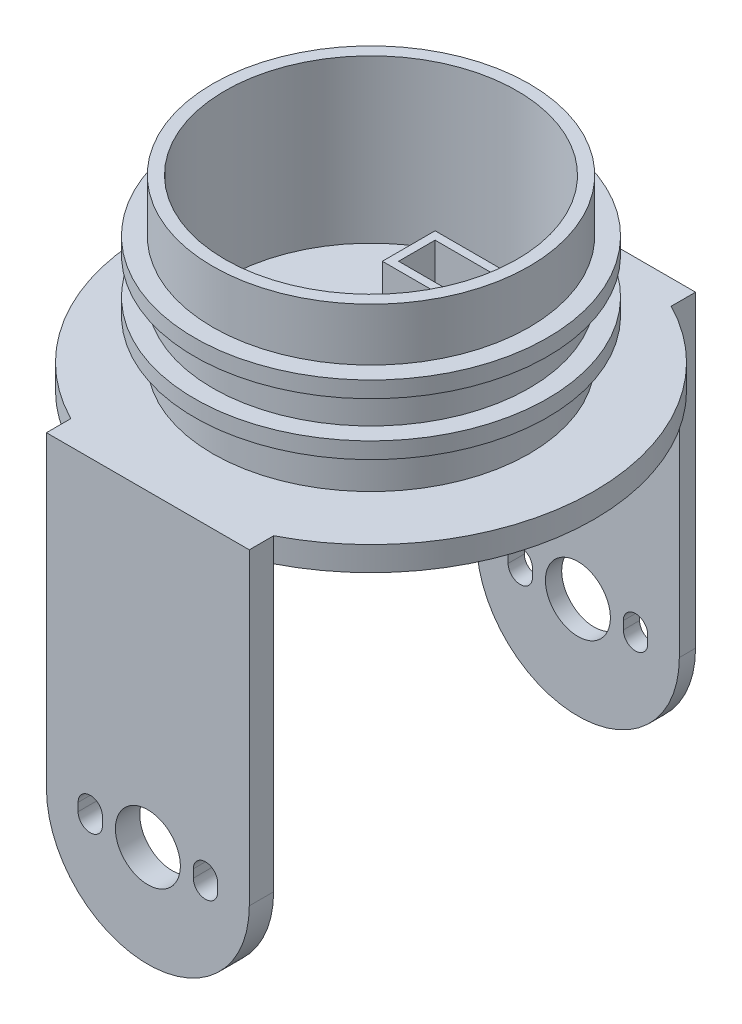
from build123d import *
from build123d.topology import SkipClean

# Parameters (mm, degrees)
SKETCH_1_R           = 19.5
SKETCH_1_R_2         = 18
EXTRUDE_1_DEPTH      = 20
SKETCH_3_R           = 27.5
EXTRUDE_2_DEPTH      = 3
EXTRUDE_START        = 2
SKETCH_25_R          = 21.75
SKETCH_25_R_2        = 19.5
EXTRUDE_12_DEPTH     = 2
EXTRUDE_START_2      = -1
SKETCH_26_R          = 21.75
SKETCH_26_R_2        = 19.5
EXTRUDE_13_DEPTH     = 2
SKETCH_27_W          = 25
SKETCH_27_H          = 51
EXTRUDE_14_DEPTH     = 3
SKETCH_28_R          = 4
EXTRUDE_17_DEPTH     = 2
EXTRUDE_START_3      = -53
SKETCH_28_15_R       = 4
EXTRUDE_19_DEPTH     = 53
SKETCH_32_W          = 2.204369859
SKETCH_32_H          = 3
EXTRUDE_20_DEPTH     = 2
CUT_EXTRUDE_START    = -50
SKETCH_28_18_R       = 4
CUT_EXTRUDE_8_DEPTH  = 50
SKETCH_33_W          = 25
SKETCH_33_H          = 3
EXTRUDE_21_DEPTH     = 3
SKETCH_34_W          = 10.2
SKETCH_34_H          = 6.5
SKETCH_34_W_2        = 8.2
SKETCH_34_H_2        = 4.5
EXTRUDE_22_DEPTH     = 5
SKETCH_37_W          = 8.2
SKETCH_37_H          = 4.5
CUT_EXTRUDE_9_DEPTH  = 5
SKETCH_38_R          = 6.3
SKETCH_38_R_2        = 4.8
EXTRUDE_23_DEPTH     = 8
CUT_EXTRUDE_10_DEPTH = 9.5
EXTRUDE_START_4      = 3
EXTRUDE_24_DEPTH     = 3


with BuildPart() as part:
    # 草圖1 → 填料-伸長1 (new body)
    with BuildSketch(Plane(origin=(0, 0, 0), x_dir=(1, 0, 0), z_dir=(0, 1, 0))):
        Circle(SKETCH_1_R)
        Circle(SKETCH_1_R_2, mode=Mode.SUBTRACT)
    extrude(amount=EXTRUDE_1_DEPTH)

    # 草圖3 → 填料-伸長2 (add)
    with BuildSketch(Plane.XZ):
        Circle(SKETCH_3_R)
    extrude(amount=EXTRUDE_2_DEPTH)

    # 草圖25 → 填料-伸長12 (add)
    with BuildSketch(Plane(origin=(0, 7, 0), x_dir=(-1, 0, 0), z_dir=(0, -1, 0)).offset(EXTRUDE_START)):
        Circle(SKETCH_25_R)
        Circle(SKETCH_25_R_2, mode=Mode.SUBTRACT)
    extrude(amount=-EXTRUDE_12_DEPTH)

    # 草圖26 → 填料-伸長13 (add)
    with BuildSketch(Plane(origin=(0, 10.5, 0), x_dir=(-1, 0, 0), z_dir=(0, -1, 0)).offset(EXTRUDE_START_2)):
        Circle(SKETCH_26_R)
        Circle(SKETCH_26_R_2, mode=Mode.SUBTRACT)
    extrude(amount=-EXTRUDE_13_DEPTH)

    # 草圖27 → 填料-伸長14 (add)
    with BuildSketch(Plane.XZ.offset(3)):
        Rectangle(SKETCH_27_W, SKETCH_27_H)
    extrude(amount=-EXTRUDE_14_DEPTH)

    # 草圖28 → 填料-伸長17 (add)
    with BuildSketch(Plane(origin=(0, 0, -25.5), x_dir=(-1, 0, 0), z_dir=(0, 0, -1))):
        with BuildLine():
            Line((12.5, 0), (-12.5, 0))
            Line((-12.5, 0), (-12.5, -38))
            ThreePointArc((-12.5, -38), (0, -50.5), (12.5, -38))
            Line((12.5, -38), (12.5, 0))
        make_face()
        with BuildLine():
            Line((8.6, -37.5), (8.6, -38.5))
            ThreePointArc((8.6, -38.5), (7.1, -40), (5.6, -38.5))
            Line((5.6, -38.5), (5.6, -37.5))
            ThreePointArc((5.6, -37.5), (7.1, -36), (8.6, -37.5))
        make_face(mode=Mode.SUBTRACT)
        with Locations((0, -38)):
            Circle(SKETCH_28_R, mode=Mode.SUBTRACT)
        with BuildLine():
            Line((-5.6, -37.5), (-5.6, -38.5))
            ThreePointArc((-5.6, -38.5), (-7.1, -40), (-8.6, -38.5))
            Line((-8.6, -38.5), (-8.6, -37.5))
            ThreePointArc((-8.6, -37.5), (-7.1, -36), (-5.6, -37.5))
        make_face(mode=Mode.SUBTRACT)
    extrude(amount=EXTRUDE_17_DEPTH)

    # 草圖28<15> → 填料-伸長19 (add)
    with BuildSketch(Plane(origin=(0, 0, -25.5), x_dir=(-1, 0, 0), z_dir=(0, 0, -1)).offset(EXTRUDE_START_3)):
        with BuildLine():
            Line((12.5, -38), (12.5, -3))
            Line((12.5, -3), (-12.5, -3))
            Line((-12.5, -3), (-12.5, -38))
            ThreePointArc((-12.5, -38), (0, -50.5), (12.5, -38))
        make_face()
        with BuildLine():
            Line((8.6, -37.5), (8.6, -38.5))
            ThreePointArc((8.6, -38.5), (7.1, -40), (5.6, -38.5))
            Line((5.6, -38.5), (5.6, -37.5))
            ThreePointArc((5.6, -37.5), (7.1, -36), (8.6, -37.5))
        make_face(mode=Mode.SUBTRACT)
        with Locations((0, -38)):
            Circle(SKETCH_28_15_R, mode=Mode.SUBTRACT)
        with BuildLine():
            Line((-5.6, -37.5), (-5.6, -38.5))
            ThreePointArc((-5.6, -38.5), (-7.1, -40), (-8.6, -38.5))
            Line((-8.6, -38.5), (-8.6, -37.5))
            ThreePointArc((-8.6, -37.5), (-7.1, -36), (-5.6, -37.5))
        make_face(mode=Mode.SUBTRACT)
    extrude(amount=EXTRUDE_19_DEPTH)

    # 草圖32 → 填料-伸長20 (add)
    with BuildSketch(Plane.XY.offset(25.5)):
        with Locations((11.397815071, -1.5)):
            Rectangle(SKETCH_32_W, SKETCH_32_H)
        with Locations((-11.397815071, -1.5)):
            Rectangle(SKETCH_32_W, SKETCH_32_H)
    extrude(amount=EXTRUDE_20_DEPTH)

    # 草圖28<18> → 除料-伸長8 (cut)
    with BuildSketch(Plane(origin=(0, 0, -25.5), x_dir=(-1, 0, 0), z_dir=(0, 0, -1)).offset(CUT_EXTRUDE_START)):
        with BuildLine():
            Line((12.5, -38), (12.5, -3))
            Line((12.5, -3), (-12.5, -3))
            Line((-12.5, -3), (-12.5, -38))
            ThreePointArc((-12.5, -38), (0, -50.5), (12.5, -38))
        make_face()
        with BuildLine():
            Line((8.6, -37.5), (8.6, -38.5))
            ThreePointArc((8.6, -38.5), (7.1, -40), (5.6, -38.5))
            Line((5.6, -38.5), (5.6, -37.5))
            ThreePointArc((5.6, -37.5), (7.1, -36), (8.6, -37.5))
        make_face(mode=Mode.SUBTRACT)
        with Locations((0, -38)):
            Circle(SKETCH_28_18_R, mode=Mode.SUBTRACT)
        with BuildLine():
            Line((-5.6, -37.5), (-5.6, -38.5))
            ThreePointArc((-5.6, -38.5), (-7.1, -40), (-8.6, -38.5))
            Line((-8.6, -38.5), (-8.6, -37.5))
            ThreePointArc((-8.6, -37.5), (-7.1, -36), (-5.6, -37.5))
        make_face(mode=Mode.SUBTRACT)
    extrude(amount=CUT_EXTRUDE_8_DEPTH, mode=Mode.SUBTRACT)

    # 草圖33 → 填料-伸長21 (add)
    with BuildSketch(Plane.XY.offset(27.5)):
        with Locations((0, -1.5)):
            Rectangle(SKETCH_33_W, SKETCH_33_H)
    extrude(amount=-EXTRUDE_21_DEPTH)

    # 草圖34 → 填料-伸長22 (add)
    with BuildSketch(Plane(origin=(0, 0, 0), x_dir=(1, 0, 0), z_dir=(0, 1, 0))):
        with Locations((0, 9.75)):
            Rectangle(SKETCH_34_W, SKETCH_34_H)
        with Locations((0, 9.75)):
            Rectangle(SKETCH_34_W_2, SKETCH_34_H_2, mode=Mode.SUBTRACT)
    extrude(amount=EXTRUDE_22_DEPTH)

    # 草圖37 → 除料-伸長9 (cut)
    with BuildSketch(Plane(origin=(0, 0, 0), x_dir=(1, 0, 0), z_dir=(0, 1, 0))):
        with Locations((0, 9.75)):
            Rectangle(SKETCH_37_W, SKETCH_37_H)
    extrude(amount=-CUT_EXTRUDE_9_DEPTH, mode=Mode.SUBTRACT)

    # 草圖38 → 填料-伸長23 (add)
    with BuildSketch(Plane(origin=(0, 0, -27.5), x_dir=(-1, 0, 0), z_dir=(0, 0, -1))):
        with Locations((0, -9.8)):
            Circle(SKETCH_38_R)
        with Locations((0, -9.8)):
            Circle(SKETCH_38_R_2, mode=Mode.SUBTRACT)
    extrude(amount=-EXTRUDE_23_DEPTH)

    # 草圖38<3> → 除料-伸長10 (cut)
    with BuildSketch(Plane(origin=(0, 0, -27.5), x_dir=(-1, 0, 0), z_dir=(0, 0, -1))):
        with BuildLine():
            ThreePointArc((4.8, -9.8), (-3.019933774, -6.069048379), (-1, -14.494677838))
            ThreePointArc((-1, -14.494677838), (0, -14.6), (1, -14.494677838))
            ThreePointArc((1, -14.494677838), (3.730951621, -12.819933774), (4.8, -9.8))
        make_face()
    extrude(amount=-CUT_EXTRUDE_10_DEPTH, mode=Mode.SUBTRACT)

    # 草圖38<4> → 填料-伸長24 (add)
    with SkipClean():  # the faces are left unmerged after this step: merging them gives an invalid solid
        with BuildSketch(Plane(origin=(0, 0, -27.5), x_dir=(-1, 0, 0), z_dir=(0, 0, -1)).offset(EXTRUDE_START_4)):
            with BuildLine():
                Line((-1.3125, -15.961764662), (-1, -14.494677838))
                ThreePointArc((-1, -14.494677838), (-3.019933774, -6.069048379), (4.8, -9.8))
                ThreePointArc((4.8, -9.8), (3.730951621, -12.819933774), (1, -14.494677838))
                Line((1, -14.494677838), (1.3125, -15.961764662))
                ThreePointArc((1.3125, -15.961764662), (4.896874003, -13.763663079), (6.3, -9.8))
                ThreePointArc((6.3, -9.8), (-3.963663079, -4.903125997), (-1.3125, -15.961764662))
            make_face()
        extrude(amount=-EXTRUDE_24_DEPTH)


solid = part.part
